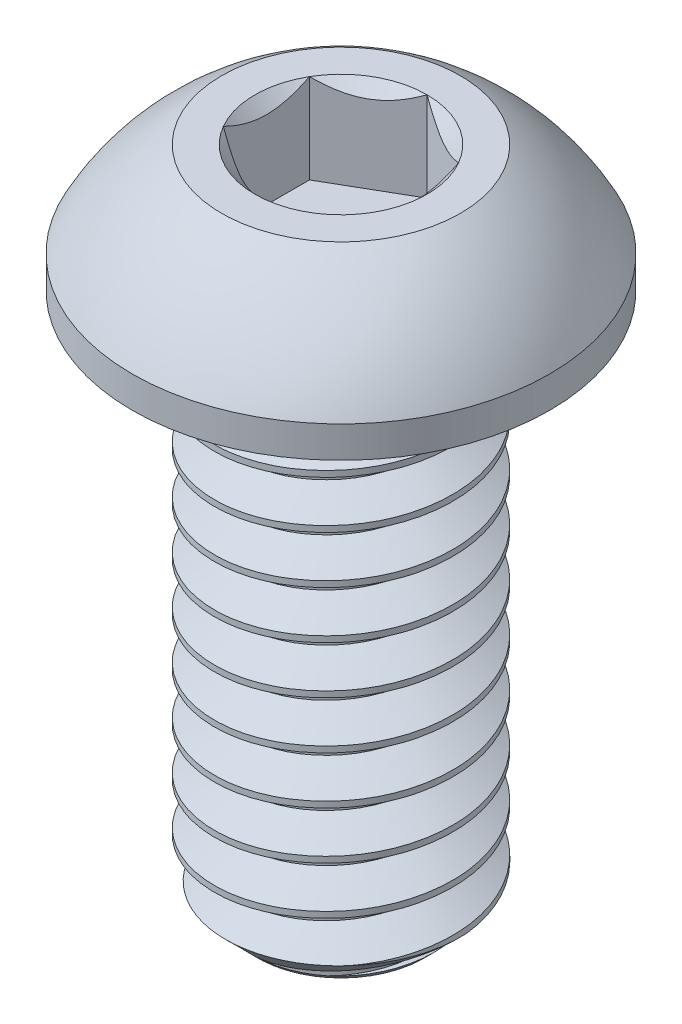
from build123d import *

# Parameters (mm, degrees)
SKETCH1_R           = 3.175
BOSS_EXTRUDE1_DEPTH = 14.2875
CUT_SWEEP1_PITCH    = 1.27
SKETCH4_OUTSIDE_W   = 14.266
SKETCH4_OUTSIDE_H   = 14.266
SKETCH4_OUTSIDE_R   = 2.21262927
CUT_EXTRUDE1_DEPTH  = 1.27
CUT_EXTRUDE1_DRAFT  = -45
CUT_EXTRUDE2_DEPTH  = 2.38125


with BuildPart() as part:
    # Sketch1 → Boss-Extrude1 (new body)
    with BuildSketch(Plane(origin=(0, 0, 0), x_dir=(1, 0, 0), z_dir=(0, 1, 0))):
        with Locations(Location((0, 0, 0), (0, 0, 270))):
            Circle(SKETCH1_R)
    extrude(amount=-BOSS_EXTRUDE1_DEPTH)

    # Cut-Sweep1: the profile of Sketch3 screwed along a right-hand helix of 12.25 turns, 8 arcs to a turn; built about Z, then put on its axis
    cut_sweep1_z = Axis((0, 0, 0), (0, 0, 1))
    cut_sweep1_corners = [(2.350110803, 0, -0.47625), (3.243740766, 0, 0.0396875), (3.243740766, 0, -1.1509375), (2.350110803, 0, -0.635)]
    with BuildLine(mode=Mode.PRIVATE) as cut_sweep1_profile:
        Line(cut_sweep1_corners[0], cut_sweep1_corners[1])
        Line(cut_sweep1_corners[1], cut_sweep1_corners[2])
        Line(cut_sweep1_corners[2], cut_sweep1_corners[3])
        Line(cut_sweep1_corners[3], cut_sweep1_corners[0])
    cut_sweep1_cap = Face(cut_sweep1_profile.wire())
    cut_sweep1_turn_angles = [0, 22.5, 45, 67.5, 90, 112.5, 135, 157.5, 180, 202.5, 225, 247.5, 270, 292.5, 315, 337.5, 360]
    cut_sweep1_turn_weights = [1, 0.9238795325112867, 1, 0.9238795325112867, 1, 0.9238795325112867, 1, 0.9238795325112867, 1, 0.9238795325112867, 1, 0.9238795325112867, 1, 0.9238795325112867, 1, 0.9238795325112867, 1]
    cut_sweep1_turn_rails = [Edge.make_bspline([Vector(p[0], p[1], 0).rotate(cut_sweep1_z, cut_sweep1_turn_angles[k]) / cut_sweep1_turn_weights[k] + Vector(0, 0, p[2] + CUT_SWEEP1_PITCH * cut_sweep1_turn_angles[k] / 360) for k in range(17)], [0, 0, 0, 1, 1, 2, 2, 3, 3, 4, 4, 5, 5, 6, 6, 7, 7, 8, 8, 8], 2, cut_sweep1_turn_weights) for p in cut_sweep1_corners]
    cut_sweep1_turn_sides = [Face.make_surface_from_curves(cut_sweep1_turn_rails[p[0]], cut_sweep1_turn_rails[p[1]]) for p in [(0, 1), (1, 2), (2, 3), (3, 0)]]
    cut_sweep1_last_angles = [4320, 4342.5, 4365, 4387.5, 4410]
    cut_sweep1_last_weights = [1, 0.9238795325112867, 1, 0.9238795325111987, 1]
    cut_sweep1_last_rails = [Edge.make_bspline([Vector(p[0], p[1], 0).rotate(cut_sweep1_z, cut_sweep1_last_angles[k]) / cut_sweep1_last_weights[k] + Vector(0, 0, p[2] + CUT_SWEEP1_PITCH * cut_sweep1_last_angles[k] / 360) for k in range(5)], [0, 0, 0, 1, 1, 2, 2, 2], 2, cut_sweep1_last_weights) for p in cut_sweep1_corners]
    cut_sweep1_last_sides = [Face.make_surface_from_curves(cut_sweep1_last_rails[p[0]], cut_sweep1_last_rails[p[1]]) for p in [(0, 1), (1, 2), (2, 3), (3, 0)]]
    cut_sweep1 = Plane(origin=(0, -14.2875, 0), x_dir=(0, 0, -1), z_dir=(0, 1, 0)) * Solid(Shell([*[p.moved(Location((0, 0, CUT_SWEEP1_PITCH * i))) for i in range(12) for p in cut_sweep1_turn_sides], *cut_sweep1_last_sides, cut_sweep1_cap, cut_sweep1_cap.rotate(cut_sweep1_z, 4410).moved(Location((0, 0, CUT_SWEEP1_PITCH * 4410 / 360)))]))
    add(cut_sweep1, mode=Mode.SUBTRACT)


with BuildPart() as cut_extrude1_tool:
    # Sketch4 outside → Cut-Extrude1 (with draft: the straight prism first)
    with BuildSketch(Plane.XZ.offset(14.2875)):
        Rectangle(SKETCH4_OUTSIDE_W, SKETCH4_OUTSIDE_H)
        Circle(SKETCH4_OUTSIDE_R, mode=Mode.SUBTRACT)
    extrude(amount=-CUT_EXTRUDE1_DEPTH)
    # Cut-Extrude1: the draft: its side faces are tilted about the plane it starts from
    cut_extrude1_sides = [cut_extrude1_tool.faces().sort_by_distance(p)[0] for p in [
        (0, -13.6525, -7.133),
        (7.133, -13.6525, 0),
        (0, -13.6525, 7.133),
        (-7.133, -13.6525, 0),
        (-2.21262927, -13.6525, 0),
    ]]
    draft(cut_extrude1_sides, Plane.XZ.offset(14.2875), CUT_EXTRUDE1_DRAFT)


with BuildPart() as part_1:
    add(part.part)

    # Cut-Extrude1: cut by cut_extrude1_tool
    add(cut_extrude1_tool.part, mode=Mode.SUBTRACT)

    # Sketch5 → Revolve1 (revolve)
    with BuildSketch(Plane.XY, mode=Mode.PRIVATE) as revolve1_sk:
        with BuildLine():
            Line((0, 3.3528), (0, 0))
            Line((0, 0), (-5.5499, 0))
            Line((-5.5499, 0), (-5.5499, 0.8382))
            ThreePointArc((-5.5499, 0.8382), (-4.540019085, 2.263204136), (-3.175, 3.3528))
            Line((-3.175, 3.3528), (0, 3.3528))
        make_face()
    revolve(revolve1_sk.sketch.rotate(Axis((0, 0, 0), (0, -1, 0)), 90), axis=Axis((0, 0, 0), (0, -1, 0)))

    # Sketch6 → Cut-Extrude2 (cut)
    with BuildSketch(Plane(origin=(0, 3.3528, 0), x_dir=(1, 0, 0), z_dir=(0, 1, 0))):
        Polygon((0, 2.291358881), (-1.984375, 1.14567944), (-1.984375, -1.14567944), (0, -2.291358881), (1.984375, -1.14567944), (1.984375, 1.14567944), align=None)
    extrude(amount=-CUT_EXTRUDE2_DEPTH, mode=Mode.SUBTRACT)

    # Cut-Extrude3 cone 1 section (through the dimple's axis) → Cut-Extrude3 (revolve, cut)
    with BuildSketch(Plane(origin=(0, 3.3528, 0), x_dir=(0, 0, 1), z_dir=(1, 0, 0))):
        Polygon((0, 0), (2.291358881, 0), (0, 2.291358881), align=None)
    revolve(axis=Axis((0, 3.3528, 0), (0, -1, 0)), mode=Mode.SUBTRACT)


solid = part_1.part
